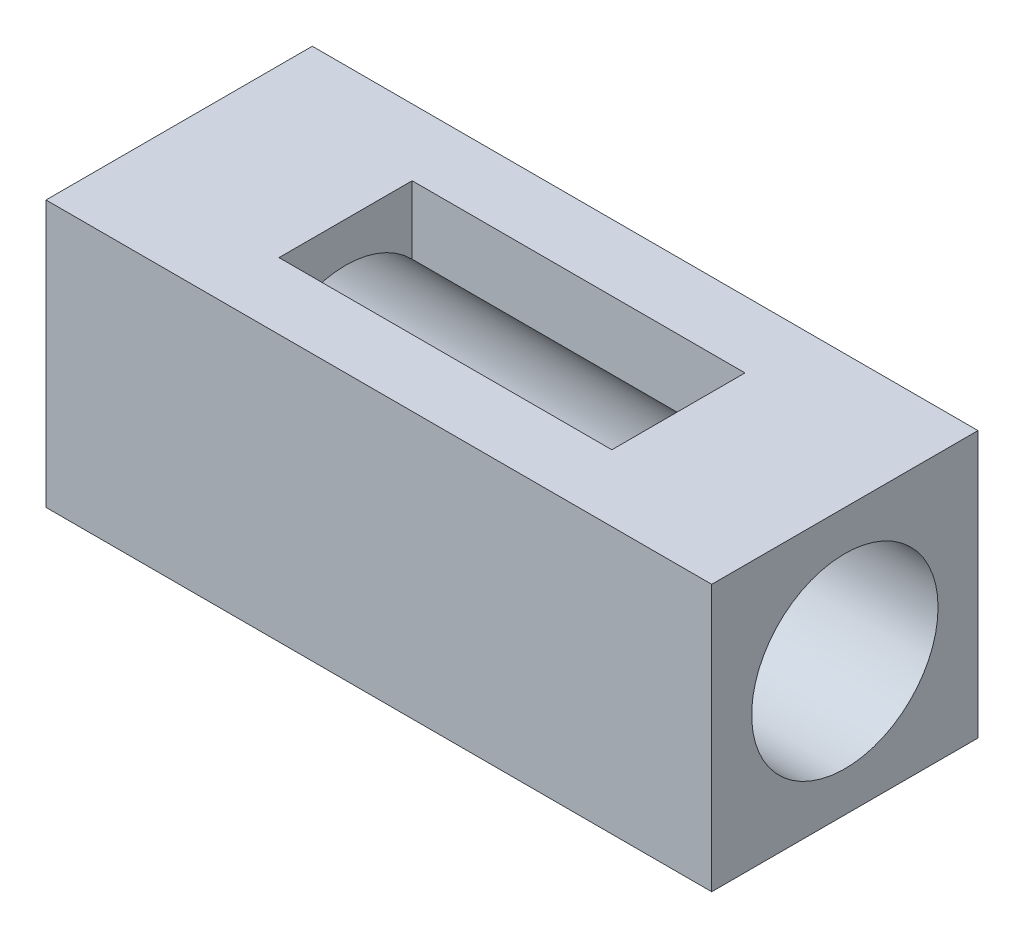
from build123d import *

# Parameters (mm, degrees)
CROQUIS1_W              = 1000
CROQUIS1_H              = 400
SALIENTE_EXTRUIR1_DEPTH = 400
CROQUIS2_R              = 140
CORTAR_EXTRUIR1_DEPTH   = 1000
CROQUIS3_W              = 500
CROQUIS3_H              = 200
CORTAR_EXTRUIR2_DEPTH   = 400


with BuildPart() as part:
    # Croquis1 → Saliente-Extruir1 (new body)
    with BuildSketch(Plane.XY):
        with Locations((500, 200)):
            Rectangle(CROQUIS1_W, CROQUIS1_H)
    extrude(amount=SALIENTE_EXTRUIR1_DEPTH)

    # Croquis2 → Cortar-Extruir1 (cut)
    with BuildSketch(Plane(origin=(1000, 0, 0), x_dir=(0, 0, -1), z_dir=(1, 0, 0))):
        with Locations((-200, 200)):
            Circle(CROQUIS2_R)
    extrude(amount=-CORTAR_EXTRUIR1_DEPTH, mode=Mode.SUBTRACT)

    # Croquis3 → Cortar-Extruir2 (cut)
    with BuildSketch(Plane.XZ):
        with Locations((500, 200)):
            Rectangle(CROQUIS3_W, CROQUIS3_H)
    extrude(amount=-CORTAR_EXTRUIR2_DEPTH, mode=Mode.SUBTRACT)


solid = part.part
